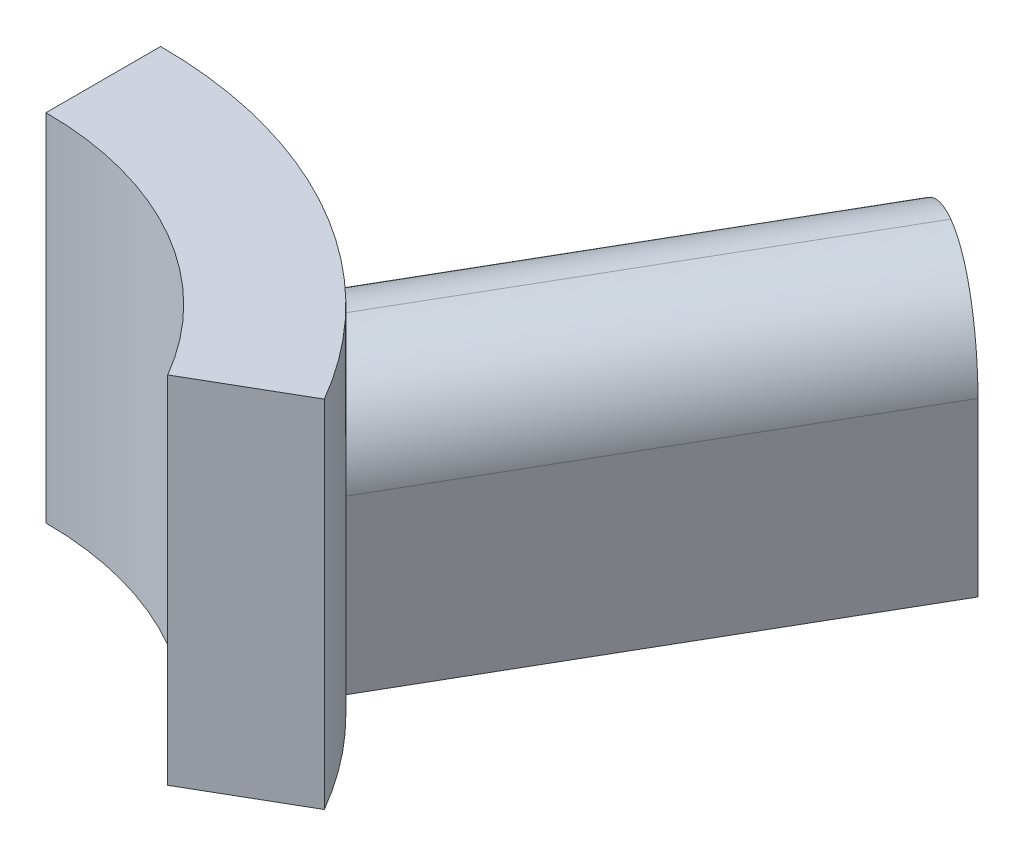
from build123d import *

# Parameters (mm, degrees)
BOSS_EXTRUDE1_DEPTH = 15.5
BOSS_EXTRUDE2_DEPTH = 11.5
FILLET1_R           = 4


with BuildPart() as part:
    # Sketch3 → Boss-Extrude1 (new body)
    with BuildSketch(Plane(origin=(0, 0, 0), x_dir=(1, 0, 0), z_dir=(0, 1, 0))):
        with BuildLine():
            Line((0, 14.5), (0, 19.5))
            ThreePointArc((0, 19.5), (9.75, 16.887495374), (16.887495374, 9.75))
            Line((16.887495374, 9.75), (12.557368355, 7.25))
            ThreePointArc((12.557368355, 7.25), (7.25, 12.557368355), (0, 14.5))
        make_face()
    extrude(amount=BOSS_EXTRUDE1_DEPTH)

    # Sketch5 → Boss-Extrude2 (add)
    with BuildSketch(Plane.XZ):
        with BuildLine():
            Line((6.078565727, -18.528384676), (16.184371608, -36.032153914))
            ThreePointArc((16.184371608, -36.032153914), (19.75, -34.208003449), (23.112574838, -32.032153914))
            Line((23.112574838, -32.032153914), (13.006768957, -14.528384676))
            ThreePointArc((13.006768957, -14.528384676), (9.75, -16.887495374), (6.078565727, -18.528384676))
        make_face()
    extrude(amount=-BOSS_EXTRUDE2_DEPTH)

    # Fillet1
    # the kernel refuses this fillet: 4 mm, written as the material it takes off along each edge
    with BuildSketch(Plane(origin=(28.112574838, 11.5, -40.692407951), x_dir=(-0.8660254037844415, 0, -0.4999999999999951), z_dir=(-0.49999999999999506, 0, 0.8660254037844415))) as fillet1_piece_1_section:
        with BuildLine():
            CenterArc((FILLET1_R, FILLET1_R), FILLET1_R, 180, 90)
            Line((0, FILLET1_R), (0, 0))
            Line((0, 0), (FILLET1_R, 0))
        make_face()
    fillet1_piece_1 = extrude(amount=40.211611762, mode=Mode.PRIVATE)
    fillet1_piece_1 = fillet1_piece_1 - Plane(origin=(0, 10.592283231, 0), x_dir=(0, 0, -1), z_dir=(0, -1, 0)) * Cylinder(19.5, 97, mode=Mode.PRIVATE)
    add(fillet1_piece_1, mode=Mode.SUBTRACT)
    with BuildSketch(Plane(origin=(1.078565727, 11.5, -9.868130638), x_dir=(0, -1, 0), z_dir=(0.49999999999999506, 0, -0.8660254037844415))) as fillet1_piece_2_section:
        with BuildLine():
            CenterArc((FILLET1_R, -FILLET1_R), FILLET1_R, 90, 90)
            Line((0, -FILLET1_R), (0, 0))
            Line((0, 0), (FILLET1_R, 0))
        make_face()
    fillet1_piece_2 = extrude(amount=40.211611762, mode=Mode.PRIVATE)
    fillet1_piece_2 = fillet1_piece_2 - Plane(origin=(0, 10.592276743, 0), x_dir=(0, 0, -1), z_dir=(0, -1, 0)) * Cylinder(19.5, 97, mode=Mode.PRIVATE)
    add(fillet1_piece_2, mode=Mode.SUBTRACT)


solid = part.part
